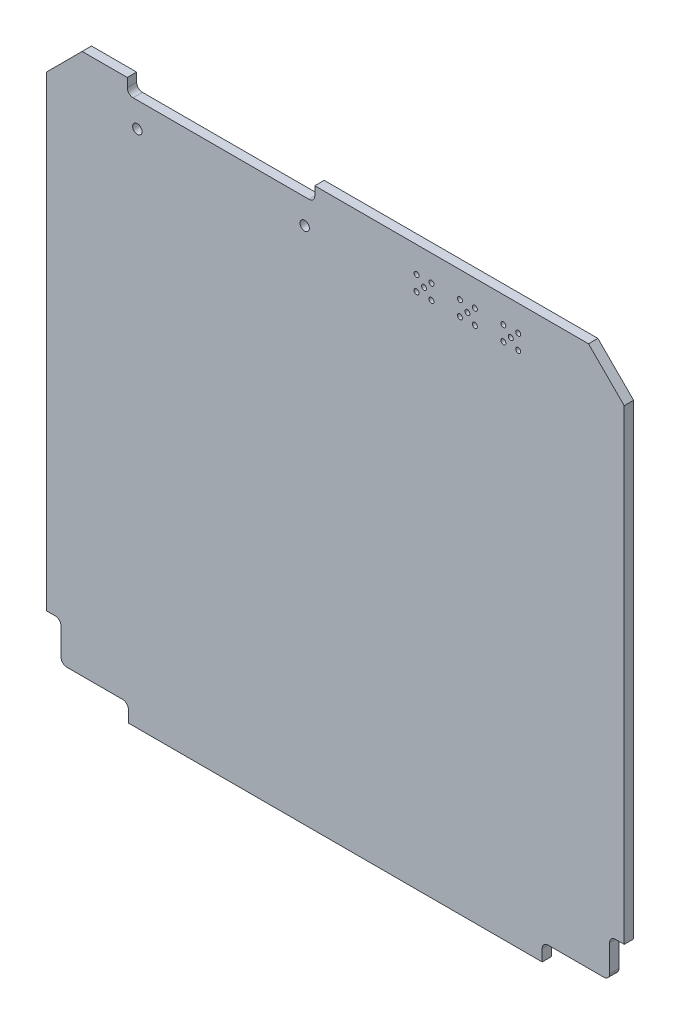
from build123d import *

# Parameters (mm, degrees)
SKETCH1_R           = 0.425
SKETCH1_R_2         = 0.8
BOSS_EXTRUDE1_DEPTH = 1.6


with BuildPart() as part:
    # Sketch1 → Boss-Extrude1 (new body)
    with BuildSketch(Plane(origin=(0, 0, -0.0125), x_dir=(-1, 0, 0), z_dir=(0, 0, -1))):
        with BuildLine():
            Line((35.3, -50), (35.3, -48))
            ThreePointArc((35.3, -48), (35.592893219, -47.292893219), (36.3, -47))
            Line((36.3, -47), (45.8, -47))
            ThreePointArc((45.8, -47), (46.507106781, -46.707106781), (46.8, -46))
            Line((46.8, -46), (46.8, -41.4))
            ThreePointArc((46.8, -41.4), (47.092893219, -40.692893219), (47.8, -40.4))
            Line((47.8, -40.4), (49.3, -40.4))
            Line((49.3, -40.4), (49.3, 39.2))
            Line((49.3, 39.2), (43.2, 45.3))
            Line((43.2, 45.3), (35.500000002, 45.3))
            Line((35.500000002, 45.3), (35.500000002, 43.8))
            ThreePointArc((35.500000002, 43.8), (35.207106783, 43.092893219), (34.500000002, 42.8))
            Line((34.500000002, 42.8), (4.499999998, 42.8))
            ThreePointArc((4.499999998, 42.8), (3.792893217, 43.092893219), (3.499999998, 43.8))
            Line((3.499999998, 43.8), (3.499999998, 45.3))
            Line((3.499999998, 45.3), (-43.2, 45.3))
            Line((-43.2, 45.3), (-49.3, 39.2))
            Line((-49.3, 39.2), (-49.3, -40.4))
            Line((-49.3, -40.4), (-47.8, -40.4))
            ThreePointArc((-47.8, -40.4), (-47.092893219, -40.692893219), (-46.8, -41.4))
            Line((-46.8, -41.4), (-46.8, -46))
            ThreePointArc((-46.8, -46), (-46.507106781, -46.707106781), (-45.8, -47))
            Line((-45.8, -47), (-36.3, -47))
            ThreePointArc((-36.3, -47), (-35.592893219, -47.292893219), (-35.3, -48))
            Line((-35.3, -48), (-35.3, -50))
            Line((-35.3, -50), (35.3, -50))
        make_face()
        with Locations((-21.27, 40.87)):
            Circle(SKETCH1_R, mode=Mode.SUBTRACT)
        with Locations((-23.81, 40.87)):
            Circle(SKETCH1_R, mode=Mode.SUBTRACT)
        with Locations((-22.54, 39.6)):
            Circle(SKETCH1_R, mode=Mode.SUBTRACT)
        with Locations((-13.87, 40.87)):
            Circle(SKETCH1_R, mode=Mode.SUBTRACT)
        with Locations((-23.81, 38.33)):
            Circle(SKETCH1_R, mode=Mode.SUBTRACT)
        with Locations((-16.41, 40.87)):
            Circle(SKETCH1_R, mode=Mode.SUBTRACT)
        with Locations((-15.14, 39.6)):
            Circle(SKETCH1_R, mode=Mode.SUBTRACT)
        with Locations((-21.27, 38.33)):
            Circle(SKETCH1_R, mode=Mode.SUBTRACT)
        with Locations((-28.67, 40.87)):
            Circle(SKETCH1_R, mode=Mode.SUBTRACT)
        with Locations((-31.21, 40.87)):
            Circle(SKETCH1_R, mode=Mode.SUBTRACT)
        with Locations((-16.41, 38.33)):
            Circle(SKETCH1_R, mode=Mode.SUBTRACT)
        with Locations((-29.94, 39.6)):
            Circle(SKETCH1_R, mode=Mode.SUBTRACT)
        with Locations((-31.21, 38.33)):
            Circle(SKETCH1_R, mode=Mode.SUBTRACT)
        with Locations((-28.67, 38.33)):
            Circle(SKETCH1_R, mode=Mode.SUBTRACT)
        with Locations((33.775, 38.54)):
            Circle(SKETCH1_R_2, mode=Mode.SUBTRACT)
        with Locations((5.225, 38.54)):
            Circle(SKETCH1_R_2, mode=Mode.SUBTRACT)
        with Locations((-13.87, 38.33)):
            Circle(SKETCH1_R, mode=Mode.SUBTRACT)
    extrude(amount=-BOSS_EXTRUDE1_DEPTH)


solid = part.part
